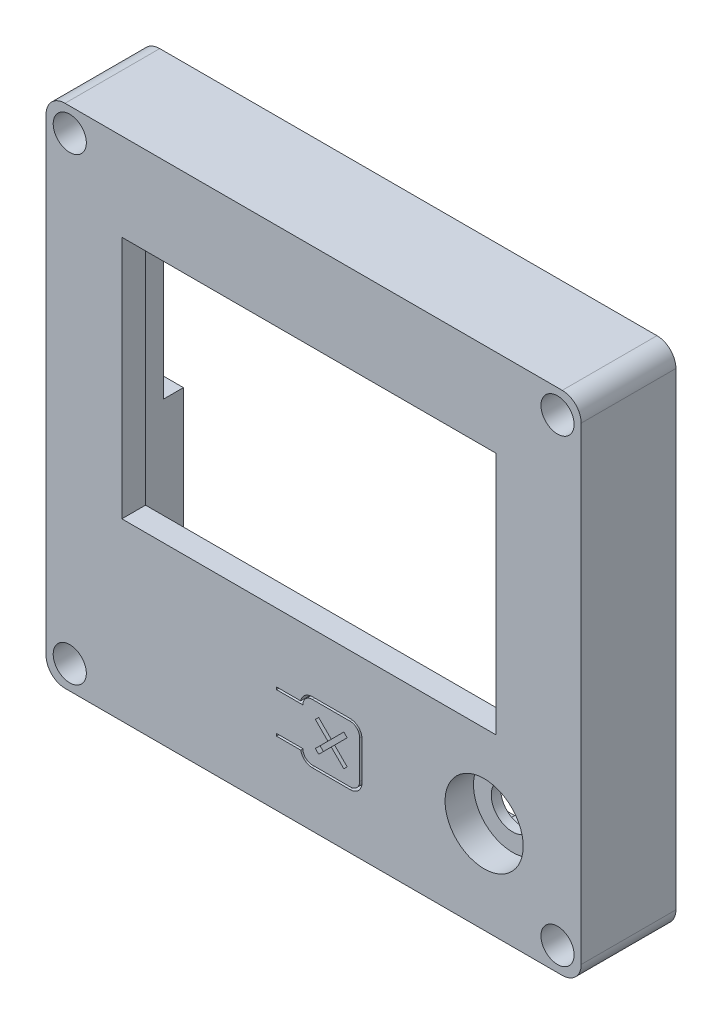
from build123d import *

# Parameters (mm, degrees)
SKETCH1_W                        = 113
SKETCH1_H                        = 107
MAIN_BODY_DEPTH                  = 5
SKETCH19_R                       = 8.75
BOSS_EXTRUDE1_DEPTH              = 3
SKETCH7_R                        = 4.5
SKETCH7_W                        = 79
SKETCH7_H                        = 51.5
SCREEN_AND_KNOB_LOCATATION_DEPTH = 79.220841213
SKETCH11_W                       = 67.654258951
SKETCH11_H                       = 30.527744354
INTERNAL_CAVITY_DEPTH            = 3
BOARDERS_DEPTH                   = 15
SKETCH6_R                        = 3.5
SCREW_HEAD_PLACEMENT_DEPTH       = 15
SKETCH10_R                       = 1.68009103
SKETCH10_R_2                     = 2
SCREW_HOLE_THROUGH_DEPTH         = 80.243296246
SKETCH14_W                       = 4.25
SKETCH14_H                       = 28
SD_CARD_SLOT_DEPTH               = 10
SKETCH15_R                       = 3
BUTTON_PRESS_DEPTH               = 8.25
GROOVE_CUT_DEPTH                 = 80.865511956
CANCEL_DECAL_DEPTH               = 1
MAIN_BODY_FILLET_R               = 4
SKETCH18_R                       = 8.25
CUT_EXTRUDE1_DEPTH               = 6


with BuildPart() as part:
    # Sketch1 → Main Body (new body)
    with BuildSketch(Plane.XY):
        Rectangle(SKETCH1_W, SKETCH1_H)
    extrude(amount=MAIN_BODY_DEPTH)

    # Sketch19 → Boss-Extrude1 (add)
    with BuildSketch(Plane(origin=(0, 0, 0), x_dir=(-1, 0, 0), z_dir=(0, 0, -1))):
        with Locations((-36, -34)):
            Circle(SKETCH19_R)
    extrude(amount=BOSS_EXTRUDE1_DEPTH)

    # Sketch7 → Screen and knob locatation (cut, through all)
    with BuildSketch(Plane.XY.offset(5)):
        with Locations((36, -34)):
            Circle(SKETCH7_R)
        with Locations((-1, 9.25)):
            Rectangle(SKETCH7_W, SKETCH7_H)
    extrude(amount=-SCREEN_AND_KNOB_LOCATATION_DEPTH, mode=Mode.SUBTRACT)

    # Sketch11 → Internal cavity (cut)
    with BuildSketch(Plane(origin=(0, 0, 0), x_dir=(-1, 0, 0), z_dir=(0, 0, -1))):
        with Locations((6.575112586, -34.017474747)):
            Rectangle(SKETCH11_W, SKETCH11_H)
    extrude(amount=-INTERNAL_CAVITY_DEPTH, mode=Mode.SUBTRACT)

    # Sketch12 → Boarders (add)
    with BuildSketch(Plane(origin=(0, 0, 0), x_dir=(-1, 0, 0), z_dir=(0, 0, -1))):
        Polygon((56.5, 43.5), (56.5, 53.5), (46.5, 53.5), (-46.5, 53.5), (-56.5, 53.5), (-56.5, 43.5), (-56.5, -43.5), (-56.5, -53.5), (-46.5, -53.5), (46.5, -53.5), (56.5, -53.5), (56.5, -43.5), align=None)
        Polygon((-47.5, 44.5), (47.5, 44.5), (47.5, -44.5), (40.402242061, -44.5), (40.402242061, -49.281346924), (-27.25201689, -49.281346924), (-27.25201689, -44.5), (-47.5, -44.5), align=None, mode=Mode.SUBTRACT)
    extrude(amount=BOARDERS_DEPTH)

    # Sketch6 → Screw Head Placement (cut)
    with BuildSketch(Plane.XY.offset(5)):
        with Locations((-51.5, 48.5)):
            Circle(SKETCH6_R)
        with Locations((-51.5, -48.5)):
            Circle(SKETCH6_R)
        with Locations((51.5, -48.5)):
            Circle(SKETCH6_R)
        with Locations((51.5, 48.5)):
            Circle(SKETCH6_R)
    extrude(amount=-SCREW_HEAD_PLACEMENT_DEPTH, mode=Mode.SUBTRACT)

    # Sketch10 → Screw hole through (cut, through all)
    with BuildSketch(Plane.XY.offset(-10)):
        with Locations((-51.5, 48.5)):
            Circle(SKETCH10_R)
        with Locations((51.5, 48.5)):
            Circle(SKETCH10_R)
        with Locations((51.5, -48.5)):
            Circle(SKETCH10_R)
        with Locations((-51.5, -48.5)):
            Circle(SKETCH10_R_2)
    extrude(amount=-SCREW_HOLE_THROUGH_DEPTH, mode=Mode.SUBTRACT)

    # Sketch14 → SD Card Slot (cut)
    with BuildSketch(Plane.ZY.offset(56.5)):
        with Locations((-12.875, 8)):
            Rectangle(SKETCH14_W, SKETCH14_H)
    extrude(amount=-SD_CARD_SLOT_DEPTH, mode=Mode.SUBTRACT)

    # Sketch15 → Button Press (add)
    with BuildSketch(Plane(origin=(0, 0, 3), x_dir=(-1, 0, 0), z_dir=(0, 0, -1))):
        with Locations((-3.7199, -35.4101)):
            Circle(SKETCH15_R)
    extrude(amount=BUTTON_PRESS_DEPTH)

    # Sketch16 → Groove Cut (cut, through all)
    with BuildSketch(Plane(origin=(0, 0, 3), x_dir=(-1, 0, 0), z_dir=(0, 0, -1))):
        with BuildLine():
            Line((2.2801, -39.4101), (7.826420717, -39.4101))
            Line((7.826420717, -39.4101), (7.826420717, -39.9101))
            Line((7.826420717, -39.9101), (2.729589743, -39.9101))
            ThreePointArc((2.729589743, -39.9101), (1.86123883, -41.346591673), (0.2801, -41.9101))
            Line((0.2801, -41.9101), (-7.7199, -41.9101))
            ThreePointArc((-7.7199, -41.9101), (-9.487666953, -41.177866953), (-10.2199, -39.4101))
            Line((-10.2199, -39.4101), (-10.2199, -31.4101))
            ThreePointArc((-10.2199, -31.4101), (-9.487666953, -29.642333047), (-7.7199, -28.9101))
            Line((-7.7199, -28.9101), (0.2801, -28.9101))
            ThreePointArc((0.2801, -28.9101), (1.86123883, -29.473608327), (2.729589743, -30.9101))
            Line((2.729589743, -30.9101), (7.826420717, -30.9101))
            Line((7.826420717, -30.9101), (7.826420717, -31.4101))
            Line((7.826420717, -31.4101), (2.2801, -31.4101))
            ThreePointArc((2.2801, -31.4101), (1.694313562, -29.995886438), (0.2801, -29.4101))
            Line((0.2801, -29.4101), (-7.7199, -29.4101))
            ThreePointArc((-7.7199, -29.4101), (-9.134113562, -29.995886438), (-9.7199, -31.4101))
            Line((-9.7199, -31.4101), (-9.7199, -39.4101))
            ThreePointArc((-9.7199, -39.4101), (-9.134113562, -40.824313562), (-7.7199, -41.4101))
            Line((-7.7199, -41.4101), (0.2801, -41.4101))
            ThreePointArc((0.2801, -41.4101), (1.694313562, -40.824313562), (2.2801, -39.4101))
        make_face()
    extrude(amount=-GROOVE_CUT_DEPTH, mode=Mode.SUBTRACT)

    # Sketch17 → CAncel Decal (cut)
    with BuildSketch(Plane.XY.offset(5)):
        Polygon((0.356446609, -32.753753391), (3.012793219, -35.4101), (0.356446609, -38.066446609), (1.063553391, -38.773553391), (3.7199, -36.117206781), (6.376246609, -38.773553391), (7.083353391, -38.066446609), (4.427006781, -35.4101), (7.083353391, -32.753753391), (6.376246609, -32.046646609), (3.7199, -34.702993219), (1.063553391, -32.046646609), align=None)
    extrude(amount=-CANCEL_DECAL_DEPTH, mode=Mode.SUBTRACT)

    # Main Body Fillet
    main_body_fillet_edges = [part.edges().sort_by_distance(p)[0] for p in [
        (-56.5, -53.5, -5),
        (56.5, -53.5, -5),
        (56.5, 53.5, -5),
        (-56.5, 53.5, -5),
    ]]
    fillet(main_body_fillet_edges, radius=MAIN_BODY_FILLET_R)

    # Sketch18 → Cut-Extrude1 (cut)
    with BuildSketch(Plane.XY.offset(5)):
        with Locations((36, -34)):
            Circle(SKETCH18_R)
    extrude(amount=-CUT_EXTRUDE1_DEPTH, mode=Mode.SUBTRACT)


solid = part.part
